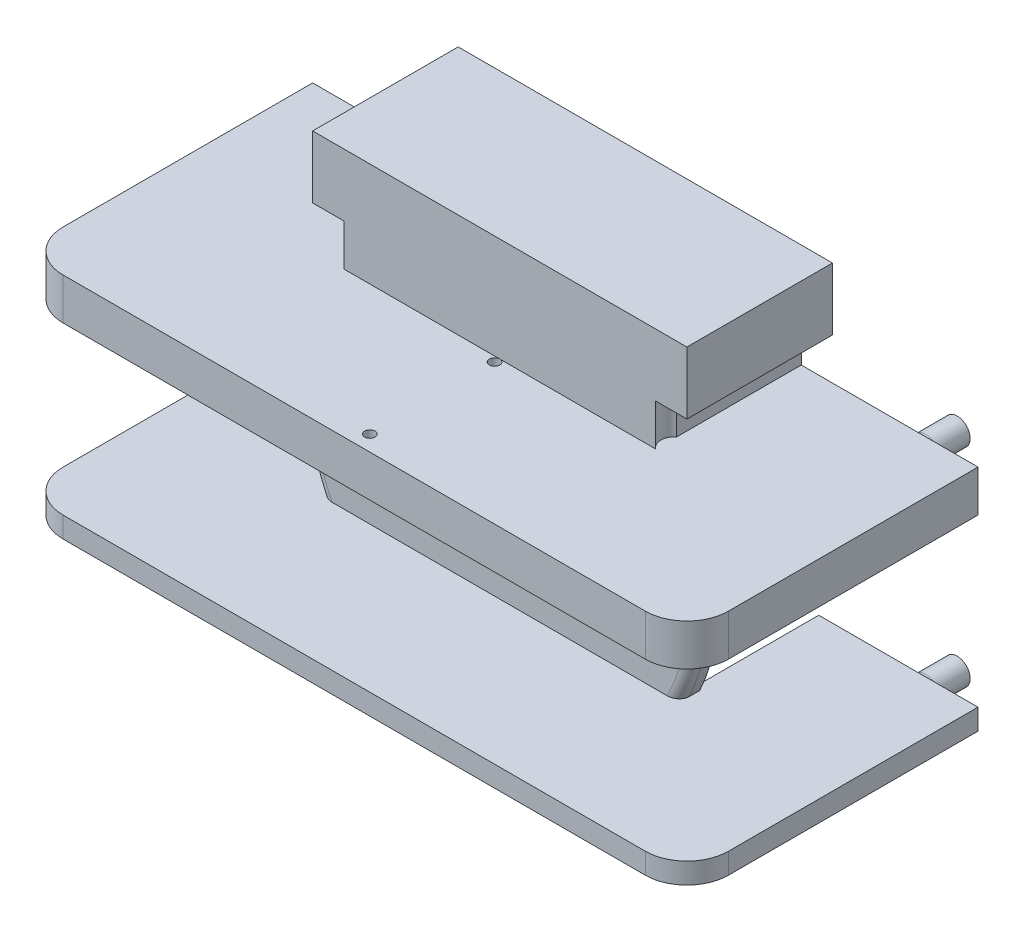
from build123d import *

# Parameters (mm, degrees)
BOSS_EXTRUDE1_DEPTH     = 1
SKETCH2_R               = 1.51
BOSS_EXTRUDE2_DEPTH     = 5.5
SKETCH3_R               = 3.5
BOSS_EXTRUDE3_DEPTH     = 1
SKETCH4_W               = 2
SKETCH4_H               = 17
BOSS_EXTRUDE4_DEPTH     = 6
SKETCH5_W               = 18
SKETCH5_H               = 2
BOSS_EXTRUDE5_DEPTH     = 6
SKETCH6_W               = 7
SKETCH6_H               = 2
BOSS_EXTRUDE6_DEPTH     = 5
BOSS_EXTRUDE7_DEPTH     = 6
CUT_EXTRUDE1_DEPTH      = 21.639767441
SKETCH9_W               = 2.937742252
SKETCH9_H               = 8
CUT_EXTRUDE2_DEPTH      = 6
CUT_EXTRUDE11_START     = -6
SKETCH21_R              = 9.25
SKETCH21_R_2            = 3.5
CUT_EXTRUDE11_DEPTH     = 6
SKETCH10_W              = 32
SKETCH10_H              = 2
BOSS_EXTRUDE8_DEPTH     = 7
FILLET1_R               = 0.5
SKETCH11_R              = 0.625
BOSS_EXTRUDE9_DEPTH     = 2
SKETCH14_W              = 3.5
SKETCH14_H              = 2
CUT_EXTRUDE5_DEPTH      = 24.937418532
SKETCH12_R              = 0.675
CUT_EXTRUDE3_DEPTH      = 2.5
CUT_EXTRUDE6_DEPTH      = 2
FILLET2_R               = 0.5
FILLET3_R               = 0.5
FILLET4_R               = 2
CUT_EXTRUDE7_DEPTH      = 25.677925456
CUT_EXTRUDE7_DEPTH_BACK = 1
SKETCH19_R              = 0.25
CUT_EXTRUDE9_DEPTH      = 2
SKETCH20_W              = 2
SKETCH20_H              = 3
CUT_EXTRUDE10_DEPTH     = 24.937418532


with BuildPart() as part:
    # Sketch1 → Boss-Extrude1 (new body)
    with BuildSketch(Plane.XY):
        Polygon((-11, 6), (-11, 11), (11, 11), (11, 6), (11, -6), (-11, -6), align=None)
    extrude(amount=BOSS_EXTRUDE1_DEPTH)

    # Sketch2 → Boss-Extrude2 (add)
    with BuildSketch(Plane(origin=(0, 0, 0), x_dir=(-1, 0, 0), z_dir=(0, 0, -1))):
        with Locations(Location((0, 0, 0), (0, 0, 180))):
            Circle(SKETCH2_R)
    extrude(amount=BOSS_EXTRUDE2_DEPTH)

    # Sketch3 → Boss-Extrude3 (add)
    with BuildSketch(Plane(origin=(0, 0, 0), x_dir=(-1, 0, 0), z_dir=(0, 0, -1))):
        with Locations(Location((0, 0, 0), (0, 0, 180))):
            Circle(SKETCH3_R)
    extrude(amount=BOSS_EXTRUDE3_DEPTH)

    # Sketch4 → Boss-Extrude4 (add)
    with BuildSketch(Plane(origin=(0, 0, 0), x_dir=(-1, 0, 0), z_dir=(0, 0, -1))):
        with Locations((10, 2.5)):
            Rectangle(SKETCH4_W, SKETCH4_H)
        with Locations((-10, 2.5)):
            Rectangle(SKETCH4_W, SKETCH4_H)
    extrude(amount=BOSS_EXTRUDE4_DEPTH)

    # Sketch5 → Boss-Extrude5 (add)
    with BuildSketch(Plane(origin=(0, 0, 0), x_dir=(-1, 0, 0), z_dir=(0, 0, -1))):
        with Locations((0, 10)):
            Rectangle(SKETCH5_W, SKETCH5_H)
    extrude(amount=BOSS_EXTRUDE5_DEPTH)

    # Sketch6 → Boss-Extrude6 (add)
    with BuildSketch(Plane(origin=(11, 0, 0), x_dir=(0, 0, -1), z_dir=(1, 0, 0))):
        with Locations((2.5, -5)):
            Rectangle(SKETCH6_W, SKETCH6_H)
        with Locations((2.5, 5)):
            Rectangle(SKETCH6_W, SKETCH6_H)
    boss_extrude6 = extrude(amount=BOSS_EXTRUDE6_DEPTH)

    # Mirror1: Boss-Extrude6 across plane
    add(boss_extrude6.mirror(Plane(origin=(0, 0, 0), x_dir=(0, 0, 1), z_dir=(1, 0, 0))))

    # Sketch7 → Boss-Extrude7 (add)
    with BuildSketch(Plane(origin=(0, 0, -6), x_dir=(-1, 0, 0), z_dir=(0, 0, -1))):
        with BuildLine():
            ThreePointArc((-6.708203932, -6), (-8.407551231, -3.211398808), (-9, 0))
            Line((-9, 0), (-9, -6))
            Line((-9, -6), (-6.708203932, -6))
        make_face()
        with BuildLine():
            Line((-9, 9), (-9, 0))
            ThreePointArc((-9, 0), (-6.363961031, 6.363961031), (0, 9))
            Line((0, 9), (-9, 9))
        make_face()
    boss_extrude7 = extrude(amount=-BOSS_EXTRUDE7_DEPTH)

    # Sketch8 → Cut-Extrude1 (cut, through all)
    with BuildSketch(Plane(origin=(0, 0, -6), x_dir=(-1, 0, 0), z_dir=(0, 0, -1))):
        with BuildLine():
            Line((-11, 4), (-8.61684397, 4))
            ThreePointArc((-8.61684397, 4), (-9.5, 0), (-8.61684397, -4))
            Line((-8.61684397, -4), (-11, -4))
            Line((-11, -4), (-11, 4))
        make_face()
    cut_extrude1 = extrude(amount=-CUT_EXTRUDE1_DEPTH, mode=Mode.SUBTRACT)

    # Sketch9 → Cut-Extrude2 (cut)
    with BuildSketch(Plane(origin=(0, 0, -6), x_dir=(-1, 0, 0), z_dir=(0, 0, -1))):
        with Locations((-9.531128874, 0)):
            Rectangle(SKETCH9_W, SKETCH9_H)
    cut_extrude2 = extrude(amount=-CUT_EXTRUDE2_DEPTH, mode=Mode.SUBTRACT)

    # Mirror2: Boss-Extrude7, Cut-Extrude1, Cut-Extrude2 across plane
    add(boss_extrude7.mirror(Plane(origin=(0, 0, 0), x_dir=(0, 0, 1), z_dir=(1, 0, 0))))
    add(cut_extrude1.mirror(Plane(origin=(0, 0, 0), x_dir=(0, 0, 1), z_dir=(1, 0, 0))), mode=Mode.SUBTRACT)
    add(cut_extrude2.mirror(Plane(origin=(0, 0, 0), x_dir=(0, 0, 1), z_dir=(1, 0, 0))), mode=Mode.SUBTRACT)

    # Sketch21 → Cut-Extrude11 (cut)
    with BuildSketch(Plane(origin=(0, 0, -6), x_dir=(-1, 0, 0), z_dir=(0, 0, -1)).offset(CUT_EXTRUDE11_START)):
        Circle(SKETCH21_R)
        with Locations(Location((0, 0, 0), (0, 0, 180))):
            Circle(SKETCH21_R_2, mode=Mode.SUBTRACT)
    extrude(amount=CUT_EXTRUDE11_DEPTH, mode=Mode.SUBTRACT)

    # Sketch10 → Boss-Extrude8 (add)
    with BuildSketch(Plane.XY.offset(1)):
        with Locations((0, -5)):
            Rectangle(SKETCH10_W, SKETCH10_H)
        with Locations((0, 5)):
            Rectangle(SKETCH10_W, SKETCH10_H)
    extrude(amount=BOSS_EXTRUDE8_DEPTH)

    # Fillet1
    fillet1_edges = [part.edges().sort_by_distance(p)[0] for p in [
        (9.5, 0, 1),
        (-9.5, 0, 1),
    ]]
    fillet(fillet1_edges, radius=FILLET1_R)

    # Sketch11 → Boss-Extrude9 (add)
    with BuildSketch(Plane(origin=(0, 0, -6), x_dir=(-1, 0, 0), z_dir=(0, 0, -1))):
        with Locations(Location((-13, -5, 0), (0, 0, 180))):
            Circle(SKETCH11_R)
    boss_extrude9 = extrude(amount=BOSS_EXTRUDE9_DEPTH)

    # Sketch14 → Cut-Extrude5 (cut, through all)
    with BuildSketch(Plane(origin=(0, 0, -6), x_dir=(-1, 0, 0), z_dir=(0, 0, -1))):
        with Locations((9.25, 7)):
            Rectangle(SKETCH14_W, SKETCH14_H)
        with Locations((-9.25, 7)):
            Rectangle(SKETCH14_W, SKETCH14_H)
    extrude(amount=-CUT_EXTRUDE5_DEPTH, mode=Mode.SUBTRACT)

    # Sketch12 → Cut-Extrude3 (cut)
    with BuildSketch(Plane(origin=(0, 0, -6), x_dir=(-1, 0, 0), z_dir=(0, 0, -1))):
        with Locations((13, -5)):
            Circle(SKETCH12_R)
    cut_extrude3 = extrude(amount=-CUT_EXTRUDE3_DEPTH, mode=Mode.SUBTRACT)

    # Sketch16 → Cut-Extrude6 (cut)
    with BuildSketch(Plane(origin=(0, 6, 0), x_dir=(1, 0, 0), z_dir=(0, 1, 0))):
        with BuildLine():
            Line((-7.5, 0), (-7.5, -1))
            ThreePointArc((-7.5, -1), (-7.25, -0.5), (-7.5, 0))
        make_face()
    cut_extrude6 = extrude(amount=CUT_EXTRUDE6_DEPTH, mode=Mode.SUBTRACT)

    # Mirror3: Boss-Extrude9, Cut-Extrude3 across plane
    add(boss_extrude9.mirror(Plane.ZX))
    add(cut_extrude3.mirror(Plane.ZX), mode=Mode.SUBTRACT)

    # Mirror4: Cut-Extrude6 across plane
    add(cut_extrude6.mirror(Plane(origin=(0, 0, 0), x_dir=(0, 0, 1), z_dir=(1, 0, 0))), mode=Mode.SUBTRACT)

    # Fillet2
    fillet2_edges = [part.edges().sort_by_distance(p)[0] for p in [
        (12.375, -5, -6),
        (12.375, 5, -6),
    ]]
    fillet(fillet2_edges, radius=FILLET2_R)

    # Fillet3
    # the kernel refuses this fillet: 0.5 mm, written as the material it takes off along each edge
    with BuildSketch(Plane(origin=(-13, -5, -6), x_dir=(-1, 0, 0), z_dir=(0, -1, 0))) as fillet3_piece_1:
        with BuildLine():
            CenterArc((0.675 + FILLET3_R, -FILLET3_R), FILLET3_R, 90, 90)
            Line((0.675, -FILLET3_R), (0.675, 0))
            Line((0.675, 0), (0.675 + FILLET3_R, 0))
        make_face()
    revolve(axis=Axis((-13, -5, -6), (0, 0, -1)), mode=Mode.SUBTRACT)
    with BuildSketch(Plane(origin=(-13, 5, -6), x_dir=(-1, 0, 0), z_dir=(0, 1, 0))) as fillet3_piece_2:
        with BuildLine():
            CenterArc((0.675 + FILLET3_R, FILLET3_R), FILLET3_R, 180, 90)
            Line((0.675, FILLET3_R), (0.675, 0))
            Line((0.675, 0), (0.675 + FILLET3_R, 0))
        make_face()
    revolve(axis=Axis((-13, 5, -6), (0, 0, 1)), mode=Mode.SUBTRACT)

    # Fillet4
    fillet4_edges = [part.edges().sort_by_distance(p)[0] for p in [
        (16, -5, 8),
        (-16, -5, 8),
        (-16, 5, 8),
        (16, 5, 8),
    ]]
    fillet(fillet4_edges, radius=FILLET4_R)

    # Sketch17 → Cut-Extrude7 (cut, two sides: drawn at the far end of the back side and taken through both)
    with BuildSketch(Plane.XZ.offset(6).offset(-CUT_EXTRUDE7_DEPTH_BACK)):
        with BuildLine():
            Line((-16, 6), (-16, -6))
            Line((-16, -6), (-14.5, -6))
            Line((-14.5, -6), (-14.5, 6))
            ThreePointArc((-14.5, 6), (-14.353553391, 6.353553391), (-14, 6.5))
            Line((-14, 6.5), (14, 6.5))
            ThreePointArc((14, 6.5), (14.353553391, 6.353553391), (14.5, 6))
            Line((14.5, 6), (14.5, -6))
            Line((14.5, -6), (16, -6))
            Line((16, -6), (16, 6))
            ThreePointArc((16, 6), (15.414213562, 7.414213562), (14, 8))
            Line((14, 8), (-14, 8))
            ThreePointArc((-14, 8), (-15.414213562, 7.414213562), (-16, 6))
        make_face()
    extrude(amount=CUT_EXTRUDE7_DEPTH + CUT_EXTRUDE7_DEPTH_BACK, mode=Mode.SUBTRACT)

    # Sketch19 → Cut-Extrude9 (cut)
    with BuildSketch(Plane(origin=(0, 6, 0), x_dir=(1, 0, 0), z_dir=(0, 1, 0))):
        with Locations(Location((0, -1.25, 0), (0, 0, 90))):
            Circle(SKETCH19_R)
        with Locations(Location((0, -7.25, 0), (0, 0, 270))):
            Circle(SKETCH19_R)
    extrude(amount=-CUT_EXTRUDE9_DEPTH, mode=Mode.SUBTRACT)

    # Sketch20 → Cut-Extrude10 (cut, through all)
    with BuildSketch(Plane(origin=(0, 0, -6), x_dir=(-1, 0, 0), z_dir=(0, 0, -1))):
        with Locations((-10, 9.5)):
            Rectangle(SKETCH20_W, SKETCH20_H)
        with Locations((10, 9.5)):
            Rectangle(SKETCH20_W, SKETCH20_H)
    extrude(amount=-CUT_EXTRUDE10_DEPTH, mode=Mode.SUBTRACT)


solid = part.part
